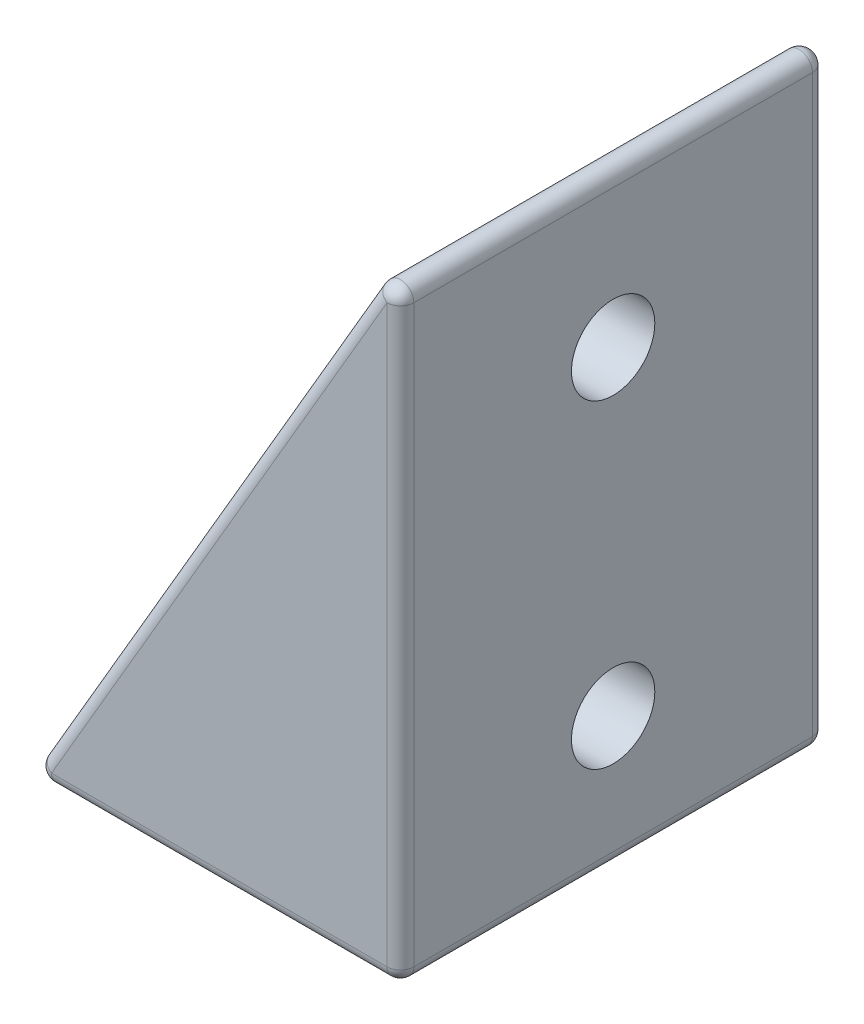
from build123d import *

# Parameters (mm, degrees)
BOSS_EXTRUDE1_DEPTH = 25.4
FILLET1_R           = 0.8
SKETCH2_R           = 2.4892
CUT_EXTRUDE1_DEPTH  = 50.8


with BuildPart() as part:
    # Sketch1 → Boss-Extrude1 (new body)
    with BuildSketch(Plane.XY):
        Polygon((0, 0), (0, 38.1), (-22.225, 0), align=None)
    extrude(amount=BOSS_EXTRUDE1_DEPTH)

    # Fillet1
    fillet1_edges = [part.edges().sort_by_distance(p)[0] for p in [
        (-11.1125, 0, 0),
        (0, 19.05, 0),
        (-11.1125, 19.05, 0),
        (-11.1125, 0, 25.4),
        (-11.1125, 19.05, 25.4),
        (-22.225, 0, 12.7),
        (0, 38.1, 12.7),
        (0, 0, 12.7),
        (0, 19.05, 25.4),
    ]]
    fillet(fillet1_edges, radius=FILLET1_R)

    # Sketch2 → Cut-Extrude1 (cut)
    with BuildSketch(Plane(origin=(0, 0, 0), x_dir=(0, 0, -1), z_dir=(1, 0, 0))):
        with Locations((-12.7, 26.885863544)):
            Circle(SKETCH2_R)
        with Locations((-12.7, 7.835863544)):
            Circle(SKETCH2_R)
    extrude(amount=-CUT_EXTRUDE1_DEPTH, mode=Mode.SUBTRACT)


solid = part.part
